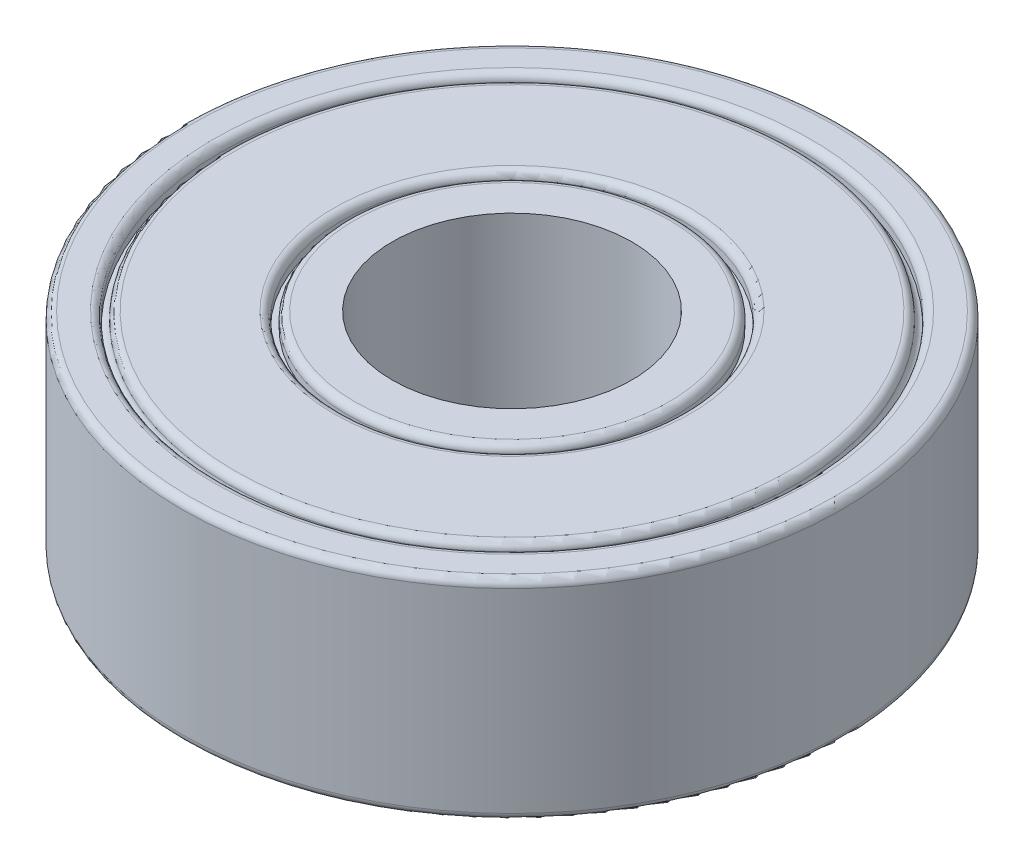
from build123d import *

# Parameters (mm, degrees)
SKETCH1_R           = 11
SKETCH1_R_2         = 4
BOSS_EXTRUDE1_DEPTH = 7
SKETCH2_R           = 9.7
SKETCH2_R_2         = 9.5
SKETCH2_R_3         = 5.7
SKETCH2_R_4         = 5.5
CUT_EXTRUDE1_DEPTH  = 0.5
FILLET1_R           = 0.25
FILLET2_R           = 0.25


with BuildPart() as part:
    # Sketch1 → Boss-Extrude1 (new body)
    with BuildSketch(Plane(origin=(0, 0, 0), x_dir=(1, 0, 0), z_dir=(0, 1, 0))):
        with Locations(Location((0, 0, 0), (0, 0, 270))):
            Circle(SKETCH1_R)
        with Locations(Location((0, 0, 0), (0, 0, 270))):
            Circle(SKETCH1_R_2, mode=Mode.SUBTRACT)
    extrude(amount=BOSS_EXTRUDE1_DEPTH)

    # Sketch2 → Cut-Extrude1 (cut)
    # profile 1 of 2: a face of its own
    with BuildSketch(Plane(origin=(0, 7, 0), x_dir=(1, 0, 0), z_dir=(0, 1, 0))):
        with Locations(Location((0, 0, 0), (0, 0, 270))):
            Circle(SKETCH2_R)
        with Locations(Location((0, 0, 0), (0, 0, 270))):
            Circle(SKETCH2_R_2, mode=Mode.SUBTRACT)
    # profile 2 of 2: a face of its own
    with BuildSketch(Plane(origin=(0, 7, 0), x_dir=(1, 0, 0), z_dir=(0, 1, 0))):
        with Locations(Location((0, 0, 0), (0, 0, 270))):
            Circle(SKETCH2_R_3)
        with Locations(Location((0, 0, 0), (0, 0, 270))):
            Circle(SKETCH2_R_4, mode=Mode.SUBTRACT)
    cut_extrude1 = extrude(amount=-CUT_EXTRUDE1_DEPTH, mode=Mode.SUBTRACT)

    # Mirror1: Cut-Extrude1 across plane
    add(cut_extrude1.mirror(Plane.ZX.offset(3.5)), mode=Mode.SUBTRACT)

    # Fillet1
    # the kernel refuses this fillet: 0.25 mm, written as the material it adds along each edge
    with BuildSketch(Plane(origin=(0, 6.5, 0), x_dir=(0, 0, 1), z_dir=(-1, 0, 0))) as fillet1_piece_1:
        with BuildLine():
            CenterArc((9.75, 0.244948974), FILLET1_R, 180, 78.463040967)
            Line((9.5, 0.244948974), (9.5, 0))
            Line((9.5, 0), (9.7, 0))
        make_face()
    revolve(axis=Axis((0, 6.5, 0), (0, 1, 0)))
    # the kernel refuses this fillet: 0.25 mm, written as the material it takes off along each edge
    with BuildSketch(Plane(origin=(0, 7, 0), x_dir=(0, 0, 1), z_dir=(-1, 0, 0))) as fillet1_2_piece_1:
        with BuildLine():
            CenterArc((9.5 - FILLET1_R, -FILLET1_R), FILLET1_R, 0, 90)
            Line((9.5 - FILLET1_R, 0), (9.5, 0))
            Line((9.5, 0), (9.5, -FILLET1_R))
        make_face()
    revolve(axis=Axis((0, 7, 0), (0, 1, 0)), mode=Mode.SUBTRACT)
    with BuildSketch(Plane(origin=(0, 7, 0), x_dir=(0, 0, 1), z_dir=(-1, 0, 0))) as fillet1_2_piece_2:
        with BuildLine():
            CenterArc((9.7 + FILLET1_R, -FILLET1_R), FILLET1_R, 90, 90)
            Line((9.7, -FILLET1_R), (9.7, 0))
            Line((9.7, 0), (9.7 + FILLET1_R, 0))
        make_face()
    revolve(axis=Axis((0, 7, 0), (0, 1, 0)), mode=Mode.SUBTRACT)
    with BuildSketch(Plane(origin=(0, 7, 0), x_dir=(0, 0, 1), z_dir=(-1, 0, 0))) as fillet1_2_piece_3:
        with BuildLine():
            CenterArc((5.5 - FILLET1_R, -FILLET1_R), FILLET1_R, 0, 90)
            Line((5.5 - FILLET1_R, 0), (5.5, 0))
            Line((5.5, 0), (5.5, -FILLET1_R))
        make_face()
    revolve(axis=Axis((0, 7, 0), (0, 1, 0)), mode=Mode.SUBTRACT)
    with BuildSketch(Plane(origin=(0, 7, 0), x_dir=(0, 0, 1), z_dir=(-1, 0, 0))) as fillet1_2_piece_4:
        with BuildLine():
            CenterArc((5.7 + FILLET1_R, -FILLET1_R), FILLET1_R, 90, 90)
            Line((5.7, -FILLET1_R), (5.7, 0))
            Line((5.7, 0), (5.7 + FILLET1_R, 0))
        make_face()
    revolve(axis=Axis((0, 7, 0), (0, 1, 0)), mode=Mode.SUBTRACT)
    with BuildSketch(Plane(origin=(0, 0, 0), x_dir=(0, 0, 1), z_dir=(-1, 0, 0))) as fillet1_2_piece_5:
        with BuildLine():
            CenterArc((9.7 + FILLET1_R, FILLET1_R), FILLET1_R, 180, 90)
            Line((9.7, FILLET1_R), (9.7, 0))
            Line((9.7, 0), (9.7 + FILLET1_R, 0))
        make_face()
    revolve(axis=Axis((0, 0, 0), (0, 1, 0)), mode=Mode.SUBTRACT)
    with BuildSketch(Plane(origin=(0, 0, 0), x_dir=(0, 0, 1), z_dir=(-1, 0, 0))) as fillet1_2_piece_6:
        with BuildLine():
            CenterArc((9.5 - FILLET1_R, FILLET1_R), FILLET1_R, 270, 90)
            Line((9.5 - FILLET1_R, 0), (9.5, 0))
            Line((9.5, 0), (9.5, FILLET1_R))
        make_face()
    revolve(axis=Axis((0, 0, 0), (0, 1, 0)), mode=Mode.SUBTRACT)
    with BuildSketch(Plane(origin=(0, 0, 0), x_dir=(0, 0, 1), z_dir=(-1, 0, 0))) as fillet1_2_piece_7:
        with BuildLine():
            CenterArc((5.7 + FILLET1_R, FILLET1_R), FILLET1_R, 180, 90)
            Line((5.7, FILLET1_R), (5.7, 0))
            Line((5.7, 0), (5.7 + FILLET1_R, 0))
        make_face()
    revolve(axis=Axis((0, 0, 0), (0, 1, 0)), mode=Mode.SUBTRACT)
    with BuildSketch(Plane(origin=(0, 0, 0), x_dir=(0, 0, 1), z_dir=(-1, 0, 0))) as fillet1_2_piece_8:
        with BuildLine():
            CenterArc((5.5 - FILLET1_R, FILLET1_R), FILLET1_R, 270, 90)
            Line((5.5 - FILLET1_R, 0), (5.5, 0))
            Line((5.5, 0), (5.5, FILLET1_R))
        make_face()
    revolve(axis=Axis((0, 0, 0), (0, 1, 0)), mode=Mode.SUBTRACT)

    # Fillet2
    fillet2_edges = [part.edges().sort_by_distance(p)[0] for p in [
        (0, 0, -11),
        (0, 7, -11),
    ]]
    fillet(fillet2_edges, radius=FILLET2_R)


solid = part.part
